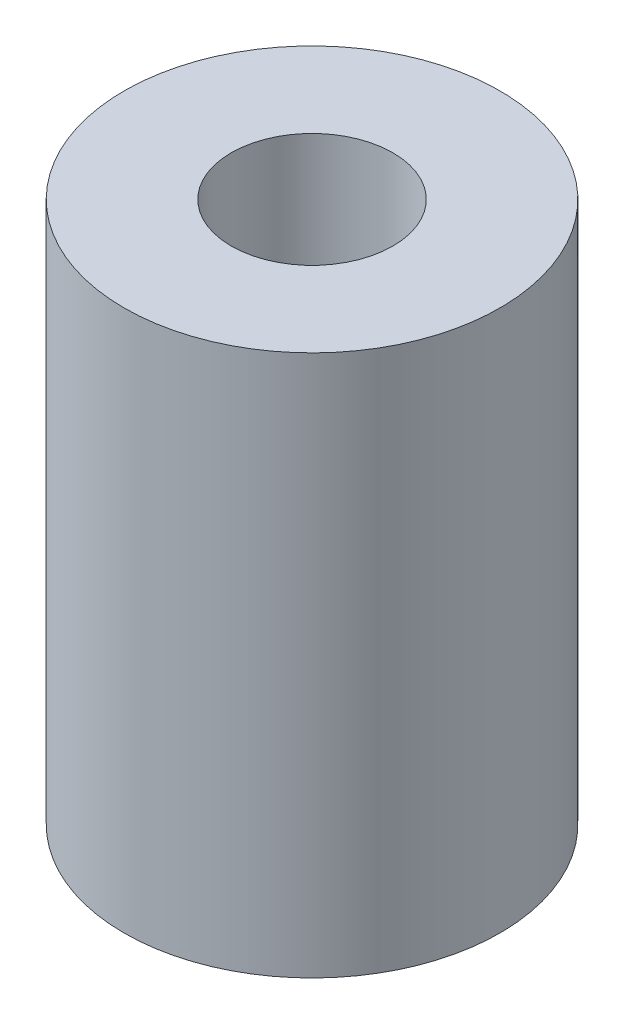
from build123d import *

# Parameters (mm, degrees)
SKETCH1_R           = 5
SKETCH1_R_2         = 2.15
BOSS_EXTRUDE1_DEPTH = 14.4


with BuildPart() as part:
    # Sketch1 → Boss-Extrude1 (new body)
    with BuildSketch(Plane(origin=(0, 0, 0), x_dir=(1, 0, 0), z_dir=(0, 1, 0))):
        Circle(SKETCH1_R)
        Circle(SKETCH1_R_2, mode=Mode.SUBTRACT)
    extrude(amount=BOSS_EXTRUDE1_DEPTH)


solid = part.part
